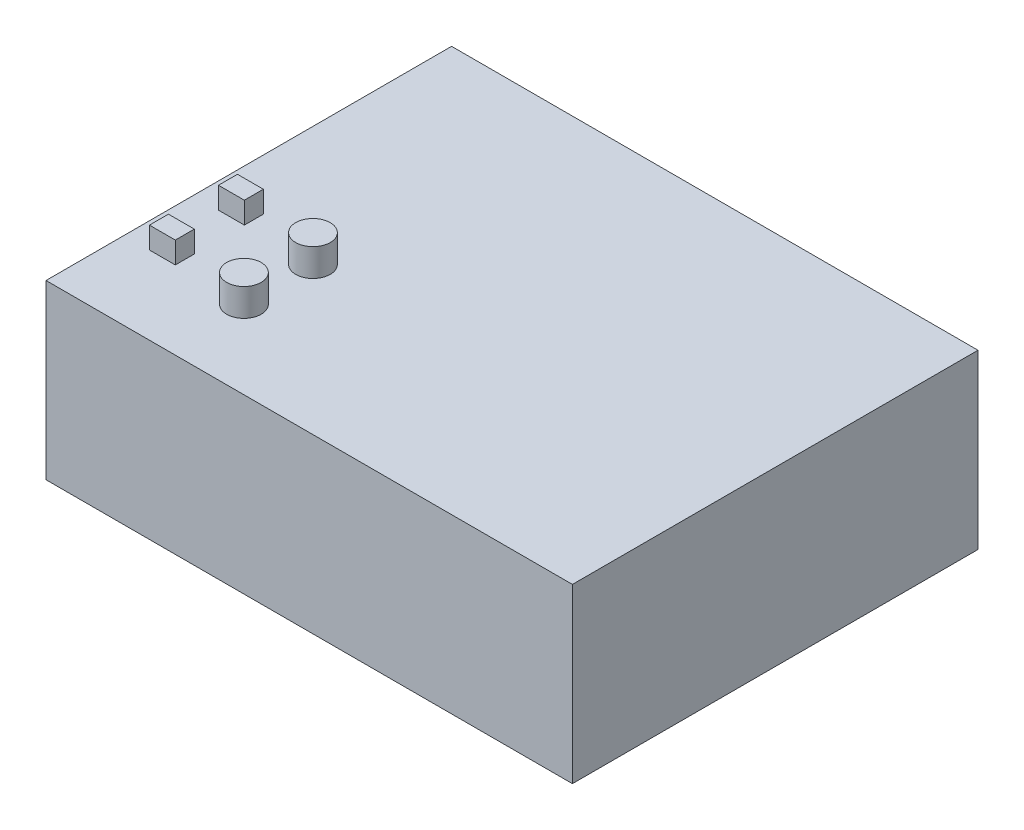
from build123d import *

# Parameters (mm, degrees)
SKETCH1_W           = 61
SKETCH1_H           = 47
BOSS_EXTRUDE1_DEPTH = 20
SKETCH2_R           = 2
BOSS_EXTRUDE2_DEPTH = 23.2
SKETCH3_W           = 3
SKETCH3_H           = 2.2
BOSS_EXTRUDE3_DEPTH = 2.5


with BuildPart() as part:
    # Sketch1 → Boss-Extrude1 (new body)
    with BuildSketch(Plane(origin=(0, 0, 0), x_dir=(1, 0, 0), z_dir=(0, 1, 0))):
        Rectangle(SKETCH1_W, SKETCH1_H)
    extrude(amount=BOSS_EXTRUDE1_DEPTH)

    # Sketch2 → Boss-Extrude2 (add)
    with BuildSketch(Plane(origin=(0, 0, 0), x_dir=(1, 0, 0), z_dir=(0, 1, 0))):
        with Locations((-16.64, -14.425)):
            Circle(SKETCH2_R)
        with Locations((-16.64, -6.425)):
            Circle(SKETCH2_R)
    extrude(amount=BOSS_EXTRUDE2_DEPTH)

    # Sketch3 → Boss-Extrude3 (add)
    with BuildSketch(Plane(origin=(0, 20, 0), x_dir=(1, 0, 0), z_dir=(0, 1, 0))):
        with Locations((-26.065, -5.35)):
            Rectangle(SKETCH3_W, SKETCH3_H)
        with Locations((-26.065, -13.35)):
            Rectangle(SKETCH3_W, SKETCH3_H)
    extrude(amount=BOSS_EXTRUDE3_DEPTH)


solid = part.part
